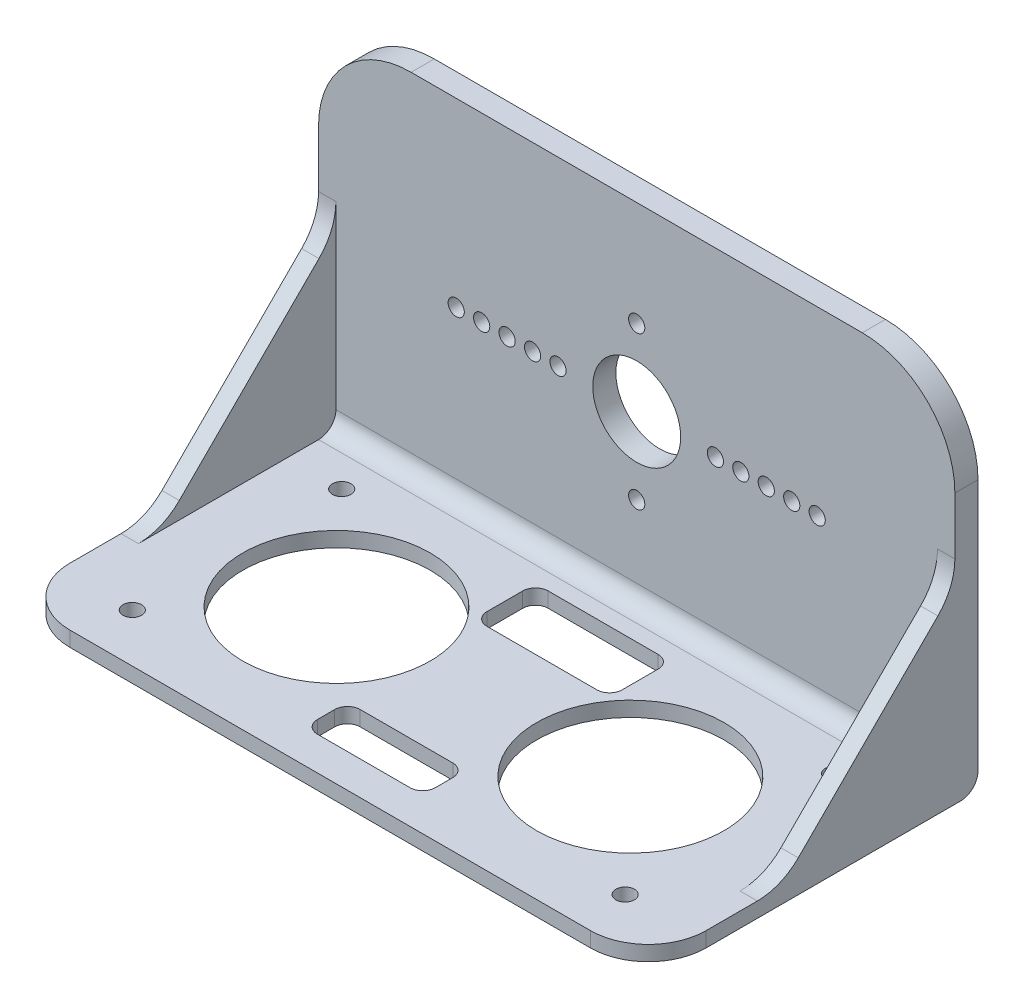
from build123d import *

# Parameters (mm, degrees)
SKETCH1_W                = 45
SKETCH1_H                = 20.5
BOSS_EXTRUDE1_DEPTH      = 1.5
SKETCH2_R                = 0.7
CUT_EXTRUDE1_DEPTH       = 1.5
SKETCH3_R                = 8
CUT_EXTRUDE2_DEPTH       = 1.5
SKETCH4_W                = 10
SKETCH4_H                = 3.5
SKETCH4_W_2              = 11.5
SKETCH4_H_2              = 5.1
CUT_EXTRUDE3_DEPTH       = 1.5
SKETCH5_W                = 45
SKETCH5_H                = 1.5
BOSS_EXTRUDE2_DEPTH      = 5
SKETCH6_W                = 45
SKETCH6_H                = 1.5
BOSS_EXTRUDE3_DEPTH      = 3
FILLET1_R                = 1
MOVE_FACE1_OUTLINE_W     = 45
MOVE_FACE1_OUTLINE_H     = 28.5
MOVE_FACE1_OUTLINE_R     = 0.7
MOVE_FACE1_OUTLINE_R_2   = 8
MOVE_FACE1_DEPTH         = 0.1
MOVE_START               = 1.4
MOVE_FACE1_2_OUTLINE_W   = 45
MOVE_FACE1_2_OUTLINE_H   = 28.5
MOVE_FACE1_2_OUTLINE_R   = 0.7
MOVE_FACE1_2_OUTLINE_R_2 = 8
MOVE_FACE1_2_DEPTH       = 0.1
MOVE_START_2             = 0.1
MOVE_FACE1_3_OUTLINE_R   = 0.8
MOVE_FACE1_3_OUTLINE_R_2 = 0.7
MOVE_FACE1_3_OUTLINE_R_3 = 8.1
MOVE_FACE1_3_OUTLINE_R_4 = 8
MOVE_FACE1_3_DEPTH       = 1.3
SKETCH7_W                = 28.5
SKETCH7_H                = 1.3
BOSS_EXTRUDE4_DEPTH      = 5
SKETCH8_W                = 55
SKETCH8_H                = 2
BOSS_EXTRUDE5_DEPTH      = 30
BOSS_EXTRUDE6_DEPTH      = 1.5
SKETCH11_R               = 3.8
CUT_EXTRUDE4_DEPTH       = 10
SKETCH13_R               = 0.7
CUT_EXTRUDE5_DEPTH       = 10
FILLET2_R                = 5
FILLET3_R                = 8
FILLET4_R                = 1.5


# Read off the part's stored shape, not the designer's step: Move Face1
with BuildPart() as part:
    # Sketch1 → Boss-Extrude1 (new body)
    with BuildSketch(Plane(origin=(0, 0, 0), x_dir=(1, 0, 0), z_dir=(0, 1, 0))):
        Rectangle(SKETCH1_W, SKETCH1_H)
    extrude(amount=BOSS_EXTRUDE1_DEPTH)

    # Sketch2 → Cut-Extrude1 (cut)
    with BuildSketch(Plane(origin=(0, 1.5, 0), x_dir=(1, 0, 0), z_dir=(0, 1, 0))):
        with Locations(Location((-21.3, 9.05, 0), (0, 0, 270))):
            Circle(SKETCH2_R)
        with Locations(Location((21.3, 9.05, 0), (0, 0, 90))):
            Circle(SKETCH2_R)
        with Locations(Location((21.3, -9.05, 0), (0, 0, 270))):
            Circle(SKETCH2_R)
        with Locations(Location((-21.3, -9.05, 0), (0, 0, 90))):
            Circle(SKETCH2_R)
    extrude(amount=-CUT_EXTRUDE1_DEPTH, mode=Mode.SUBTRACT)

    # Sketch3 → Cut-Extrude2 (cut)
    with BuildSketch(Plane(origin=(0, 1.5, 0), x_dir=(1, 0, 0), z_dir=(0, 1, 0))):
        with Locations(Location((12.7, 0, 0), (0, 0, 270))):
            Circle(SKETCH3_R)
        with Locations(Location((-12.7, 0, 0), (0, 0, 90))):
            Circle(SKETCH3_R)
    extrude(amount=-CUT_EXTRUDE2_DEPTH, mode=Mode.SUBTRACT)

    # Sketch4 → Cut-Extrude3 (cut)
    with BuildSketch(Plane(origin=(0, 1.5, 0), x_dir=(1, 0, 0), z_dir=(0, 1, 0))):
        with Locations((0, -8.5)):
            Rectangle(SKETCH4_W, SKETCH4_H)
        with Locations((0, 7.7)):
            Rectangle(SKETCH4_W_2, SKETCH4_H_2)
    extrude(amount=-CUT_EXTRUDE3_DEPTH, mode=Mode.SUBTRACT)

    # Sketch5 → Boss-Extrude2 (add)
    with BuildSketch(Plane(origin=(0, 0, -10.25), x_dir=(-1, 0, 0), z_dir=(0, 0, -1))):
        with Locations((0, 0.75)):
            Rectangle(SKETCH5_W, SKETCH5_H)
    extrude(amount=BOSS_EXTRUDE2_DEPTH)

    # Sketch6 → Boss-Extrude3 (add)
    with BuildSketch(Plane.XY.offset(10.25)):
        with Locations((0, 0.75)):
            Rectangle(SKETCH6_W, SKETCH6_H)
    extrude(amount=BOSS_EXTRUDE3_DEPTH)

    # Fillet1
    fillet1_edges = [part.edges().sort_by_distance(p)[0] for p in [
        (5, 0.75, 6.75),
        (5, 0.75, 10.25),
        (-5, 0.75, 10.25),
        (-5, 0.75, 6.75),
        (5.75, 0.75, -10.25),
        (5.75, 0.75, -5.15),
        (-5.75, 0.75, -5.15),
        (-5.75, 0.75, -10.25),
    ]]
    fillet(fillet1_edges, radius=FILLET1_R)

    # Move Face1 outline → Move Face1 (cut)
    with BuildSketch(Plane(origin=(0, 0, 0), x_dir=(1, 0, 0), z_dir=(0, 1, 0))):
        with Locations((0, 1)):
            Rectangle(MOVE_FACE1_OUTLINE_W, MOVE_FACE1_OUTLINE_H)
        with Locations((-21.3, 9.05)):
            Circle(MOVE_FACE1_OUTLINE_R, mode=Mode.SUBTRACT)
        with Locations((-21.3, -9.05)):
            Circle(MOVE_FACE1_OUTLINE_R, mode=Mode.SUBTRACT)
        with Locations((-12.7, 0)):
            Circle(MOVE_FACE1_OUTLINE_R_2, mode=Mode.SUBTRACT)
        with BuildLine():
            Line((5, -7.75), (5, -9.25))
            ThreePointArc((5, -9.25), (4.707106781, -9.957106781), (4, -10.25))
            Line((4, -10.25), (-4, -10.25))
            ThreePointArc((-4, -10.25), (-4.707106781, -9.957106781), (-5, -9.25))
            Line((-5, -9.25), (-5, -7.75))
            ThreePointArc((-5, -7.75), (-4.707106781, -7.042893219), (-4, -6.75))
            Line((-4, -6.75), (4, -6.75))
            ThreePointArc((4, -6.75), (4.707106781, -7.042893219), (5, -7.75))
        make_face(mode=Mode.SUBTRACT)
        with Locations((21.3, -9.05)):
            Circle(MOVE_FACE1_OUTLINE_R, mode=Mode.SUBTRACT)
        with Locations((12.7, 0)):
            Circle(MOVE_FACE1_OUTLINE_R_2, mode=Mode.SUBTRACT)
        with Locations((21.3, 9.05)):
            Circle(MOVE_FACE1_OUTLINE_R, mode=Mode.SUBTRACT)
        with BuildLine():
            Line((5.75, 9.25), (5.75, 6.15))
            ThreePointArc((5.75, 6.15), (5.457106781, 5.442893219), (4.75, 5.15))
            Line((4.75, 5.15), (-4.75, 5.15))
            ThreePointArc((-4.75, 5.15), (-5.457106781, 5.442893219), (-5.75, 6.15))
            Line((-5.75, 6.15), (-5.75, 9.25))
            ThreePointArc((-5.75, 9.25), (-5.457106781, 9.957106781), (-4.75, 10.25))
            Line((-4.75, 10.25), (4.75, 10.25))
            ThreePointArc((4.75, 10.25), (5.457106781, 9.957106781), (5.75, 9.25))
        make_face(mode=Mode.SUBTRACT)
    extrude(amount=MOVE_FACE1_DEPTH, mode=Mode.SUBTRACT)

    # Move Face1 2 outline → Move Face1 2 (cut)
    with BuildSketch(Plane(origin=(0, 0, 0), x_dir=(1, 0, 0), z_dir=(0, 1, 0)).offset(MOVE_START)):
        with Locations((0, 1)):
            Rectangle(MOVE_FACE1_2_OUTLINE_W, MOVE_FACE1_2_OUTLINE_H)
        with Locations((-21.3, 9.05)):
            Circle(MOVE_FACE1_2_OUTLINE_R, mode=Mode.SUBTRACT)
        with Locations((-21.3, -9.05)):
            Circle(MOVE_FACE1_2_OUTLINE_R, mode=Mode.SUBTRACT)
        with Locations((-12.7, 0)):
            Circle(MOVE_FACE1_2_OUTLINE_R_2, mode=Mode.SUBTRACT)
        with BuildLine():
            Line((5, -7.75), (5, -9.25))
            ThreePointArc((5, -9.25), (4.707106781, -9.957106781), (4, -10.25))
            Line((4, -10.25), (-4, -10.25))
            ThreePointArc((-4, -10.25), (-4.707106781, -9.957106781), (-5, -9.25))
            Line((-5, -9.25), (-5, -7.75))
            ThreePointArc((-5, -7.75), (-4.707106781, -7.042893219), (-4, -6.75))
            Line((-4, -6.75), (4, -6.75))
            ThreePointArc((4, -6.75), (4.707106781, -7.042893219), (5, -7.75))
        make_face(mode=Mode.SUBTRACT)
        with Locations((21.3, -9.05)):
            Circle(MOVE_FACE1_2_OUTLINE_R, mode=Mode.SUBTRACT)
        with Locations((12.7, 0)):
            Circle(MOVE_FACE1_2_OUTLINE_R_2, mode=Mode.SUBTRACT)
        with Locations((21.3, 9.05)):
            Circle(MOVE_FACE1_2_OUTLINE_R, mode=Mode.SUBTRACT)
        with BuildLine():
            Line((5.75, 9.25), (5.75, 6.15))
            ThreePointArc((5.75, 6.15), (5.457106781, 5.442893219), (4.75, 5.15))
            Line((4.75, 5.15), (-4.75, 5.15))
            ThreePointArc((-4.75, 5.15), (-5.457106781, 5.442893219), (-5.75, 6.15))
            Line((-5.75, 6.15), (-5.75, 9.25))
            ThreePointArc((-5.75, 9.25), (-5.457106781, 9.957106781), (-4.75, 10.25))
            Line((-4.75, 10.25), (4.75, 10.25))
            ThreePointArc((4.75, 10.25), (5.457106781, 9.957106781), (5.75, 9.25))
        make_face(mode=Mode.SUBTRACT)
    extrude(amount=MOVE_FACE1_2_DEPTH, mode=Mode.SUBTRACT)

    # Move Face1 3 outline → Move Face1 3 (cut)
    # profile 1 of 8: a face of its own
    with BuildSketch(Plane(origin=(0, 0, 0), x_dir=(1, 0, 0), z_dir=(0, 1, 0)).offset(MOVE_START_2)):
        with Locations((-21.3, 9.05)):
            Circle(MOVE_FACE1_3_OUTLINE_R)
        with Locations((-21.3, 9.05)):
            Circle(MOVE_FACE1_3_OUTLINE_R_2, mode=Mode.SUBTRACT)
    # profile 2 of 8: a face of its own
    with BuildSketch(Plane(origin=(0, 0, 0), x_dir=(1, 0, 0), z_dir=(0, 1, 0)).offset(MOVE_START_2)):
        with Locations((21.3, 9.05)):
            Circle(MOVE_FACE1_3_OUTLINE_R)
        with Locations((21.3, 9.05)):
            Circle(MOVE_FACE1_3_OUTLINE_R_2, mode=Mode.SUBTRACT)
    # profile 3 of 8: a face of its own
    with BuildSketch(Plane(origin=(0, 0, 0), x_dir=(1, 0, 0), z_dir=(0, 1, 0)).offset(MOVE_START_2)):
        with Locations((21.3, -9.05)):
            Circle(MOVE_FACE1_3_OUTLINE_R)
        with Locations((21.3, -9.05)):
            Circle(MOVE_FACE1_3_OUTLINE_R_2, mode=Mode.SUBTRACT)
    # profile 4 of 8: a face of its own
    with BuildSketch(Plane(origin=(0, 0, 0), x_dir=(1, 0, 0), z_dir=(0, 1, 0)).offset(MOVE_START_2)):
        with Locations((-21.3, -9.05)):
            Circle(MOVE_FACE1_3_OUTLINE_R)
        with Locations((-21.3, -9.05)):
            Circle(MOVE_FACE1_3_OUTLINE_R_2, mode=Mode.SUBTRACT)
    # profile 5 of 8: a face of its own
    with BuildSketch(Plane(origin=(0, 0, 0), x_dir=(1, 0, 0), z_dir=(0, 1, 0)).offset(MOVE_START_2)):
        with Locations((-12.7, 0)):
            Circle(MOVE_FACE1_3_OUTLINE_R_3)
        with Locations((-12.7, 0)):
            Circle(MOVE_FACE1_3_OUTLINE_R_4, mode=Mode.SUBTRACT)
    # profile 6 of 8: a face of its own
    with BuildSketch(Plane(origin=(0, 0, 0), x_dir=(1, 0, 0), z_dir=(0, 1, 0)).offset(MOVE_START_2)):
        with Locations((12.7, 0)):
            Circle(MOVE_FACE1_3_OUTLINE_R_3)
        with Locations((12.7, 0)):
            Circle(MOVE_FACE1_3_OUTLINE_R_4, mode=Mode.SUBTRACT)
    # profile 7 of 8: a face of its own
    with BuildSketch(Plane(origin=(0, 0, 0), x_dir=(1, 0, 0), z_dir=(0, 1, 0)).offset(MOVE_START_2)):
        with BuildLine():
            ThreePointArc((4.75, 5.05), (5.527817459, 5.372182541), (5.85, 6.15))
            Line((5.85, 6.15), (5.85, 9.25))
            ThreePointArc((5.85, 9.25), (5.527817459, 10.027817459), (4.75, 10.35))
            Line((4.75, 10.35), (-4.75, 10.35))
            ThreePointArc((-4.75, 10.35), (-5.527817459, 10.027817459), (-5.85, 9.25))
            Line((-5.85, 9.25), (-5.85, 6.15))
            ThreePointArc((-5.85, 6.15), (-5.527817459, 5.372182541), (-4.75, 5.05))
            Line((-4.75, 5.05), (4.75, 5.05))
        make_face()
        with BuildLine():
            Line((5.75, 9.25), (5.75, 6.15))
            ThreePointArc((5.75, 6.15), (5.457106781, 5.442893219), (4.75, 5.15))
            Line((4.75, 5.15), (-4.75, 5.15))
            ThreePointArc((-4.75, 5.15), (-5.457106781, 5.442893219), (-5.75, 6.15))
            Line((-5.75, 6.15), (-5.75, 9.25))
            ThreePointArc((-5.75, 9.25), (-5.457106781, 9.957106781), (-4.75, 10.25))
            Line((-4.75, 10.25), (4.75, 10.25))
            ThreePointArc((4.75, 10.25), (5.457106781, 9.957106781), (5.75, 9.25))
        make_face(mode=Mode.SUBTRACT)
    # profile 8 of 8: a face of its own
    with BuildSketch(Plane(origin=(0, 0, 0), x_dir=(1, 0, 0), z_dir=(0, 1, 0)).offset(MOVE_START_2)):
        with BuildLine():
            ThreePointArc((4, -10.35), (4.777817459, -10.027817459), (5.1, -9.25))
            Line((5.1, -9.25), (5.1, -7.75))
            ThreePointArc((5.1, -7.75), (4.777817459, -6.972182541), (4, -6.65))
            Line((4, -6.65), (-4, -6.65))
            ThreePointArc((-4, -6.65), (-4.777817459, -6.972182541), (-5.1, -7.75))
            Line((-5.1, -7.75), (-5.1, -9.25))
            ThreePointArc((-5.1, -9.25), (-4.777817459, -10.027817459), (-4, -10.35))
            Line((-4, -10.35), (4, -10.35))
        make_face()
        with BuildLine():
            Line((5, -7.75), (5, -9.25))
            ThreePointArc((5, -9.25), (4.707106781, -9.957106781), (4, -10.25))
            Line((4, -10.25), (-4, -10.25))
            ThreePointArc((-4, -10.25), (-4.707106781, -9.957106781), (-5, -9.25))
            Line((-5, -9.25), (-5, -7.75))
            ThreePointArc((-5, -7.75), (-4.707106781, -7.042893219), (-4, -6.75))
            Line((-4, -6.75), (4, -6.75))
            ThreePointArc((4, -6.75), (4.707106781, -7.042893219), (5, -7.75))
        make_face(mode=Mode.SUBTRACT)
    extrude(amount=MOVE_FACE1_3_DEPTH, mode=Mode.SUBTRACT)

    # Sketch7 → Boss-Extrude4 (add)
    with BuildSketch(Plane.ZY.offset(22.5)):
        with Locations((-1, 0.75)):
            Rectangle(SKETCH7_W, SKETCH7_H)
    boss_extrude4 = extrude(amount=BOSS_EXTRUDE4_DEPTH)

    # Mirror1: Boss-Extrude4 across plane
    add(boss_extrude4.mirror(Plane(origin=(0, 0, 0), x_dir=(0, 0, 1), z_dir=(1, 0, 0))))

    # Sketch8 → Boss-Extrude5 (add)
    with BuildSketch(Plane(origin=(0, 1.4, 0), x_dir=(1, 0, 0), z_dir=(0, 1, 0))):
        with Locations((0, 14.25)):
            Rectangle(SKETCH8_W, SKETCH8_H)
    extrude(amount=BOSS_EXTRUDE5_DEPTH)

    # Sketch9 → Boss-Extrude6 (add)
    with BuildSketch(Plane(origin=(27.5, 0, 0), x_dir=(0, 0, -1), z_dir=(1, 0, 0))):
        Polygon((-1.75, 1.4), (13.25, 16.4), (13.25, 1.4), align=None)
    boss_extrude6 = extrude(amount=-BOSS_EXTRUDE6_DEPTH)

    # Mirror2: Boss-Extrude6 across plane
    add(boss_extrude6.mirror(Plane(origin=(0, 0, 0), x_dir=(0, 0, 1), z_dir=(1, 0, 0))))

    # Sketch11 → Cut-Extrude4 (cut)
    with BuildSketch(Plane.XY.offset(-13.25)):
        with Locations((0, 15.75)):
            Circle(SKETCH11_R)
    extrude(amount=-CUT_EXTRUDE4_DEPTH, mode=Mode.SUBTRACT)

    # Sketch13 → Cut-Extrude5 (cut)
    with BuildSketch(Plane.XY.offset(-13.25)):
        with Locations((-6.8, 15.75)):
            Circle(SKETCH13_R)
        with Locations((-9, 15.75)):
            Circle(SKETCH13_R)
        with Locations((-11.2, 15.75)):
            Circle(SKETCH13_R)
        with Locations((-13.4, 15.75)):
            Circle(SKETCH13_R)
        with Locations((-15.6, 15.75)):
            Circle(SKETCH13_R)
        with Locations((0, 22.35)):
            Circle(SKETCH13_R)
        with Locations((0, 9.15)):
            Circle(SKETCH13_R)
        with Locations(Location((15.6, 15.75, 0), (0, 0, 180))):
            Circle(SKETCH13_R)
        with Locations((13.4, 15.75)):
            Circle(SKETCH13_R)
        with Locations((11.2, 15.75)):
            Circle(SKETCH13_R)
        with Locations((9, 15.75)):
            Circle(SKETCH13_R)
        with Locations((6.8, 15.75)):
            Circle(SKETCH13_R)
    extrude(amount=-CUT_EXTRUDE5_DEPTH, mode=Mode.SUBTRACT)

    # Fillet2
    fillet2_edges = [part.edges().sort_by_distance(p)[0] for p in [
        (-27.5, 0.75, 13.25),
        (27.5, 0.75, 13.25),
        (26.75, 1.4, 1.75),
        (26.75, 16.4, -13.25),
        (-26.75, 1.4, 1.75),
        (-26.75, 16.4, -13.25),
    ]]
    fillet(fillet2_edges, radius=FILLET2_R)

    # Fillet3
    fillet3_edges = [part.edges().sort_by_distance(p)[0] for p in [
        (-27.5, 31.4, -14.25),
        (27.5, 31.4, -14.25),
    ]]
    fillet(fillet3_edges, radius=FILLET3_R)

    # Fillet4
    fillet4_edges = [part.edges().sort_by_distance(p)[0] for p in [
        (0, 1.4, -13.25),
        (0, 0.1, -15.25),
    ]]
    fillet(fillet4_edges, radius=FILLET4_R)


solid = part.part
